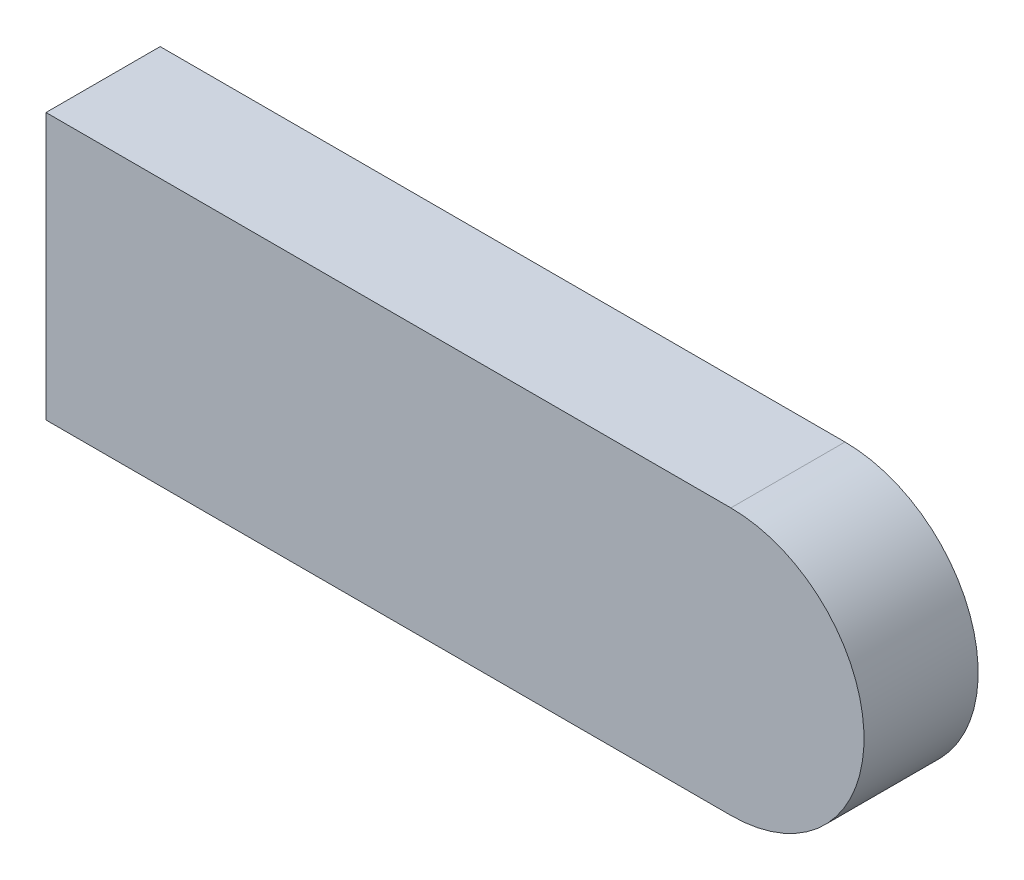
from build123d import *

# Parameters (mm, degrees)
BOSS_EXTRUDE2_DEPTH = 30


with BuildPart() as part:
    # Sketch1 → Boss-Extrude2 (new body)
    with BuildSketch(Plane.XY):
        with BuildLine():
            Line((1447.396517475, 2049.170303346), (1267.396517475, 2049.170303346))
            Line((1267.396517475, 2049.170303346), (1267.396517475, 1979.170303346))
            Line((1267.396517475, 1979.170303346), (1447.396517475, 1979.170303346))
            ThreePointArc((1447.396517475, 1979.170303346), (1482.396517475, 2014.170303346), (1447.396517475, 2049.170303346))
        make_face()
    extrude(amount=BOSS_EXTRUDE2_DEPTH)


solid = part.part
